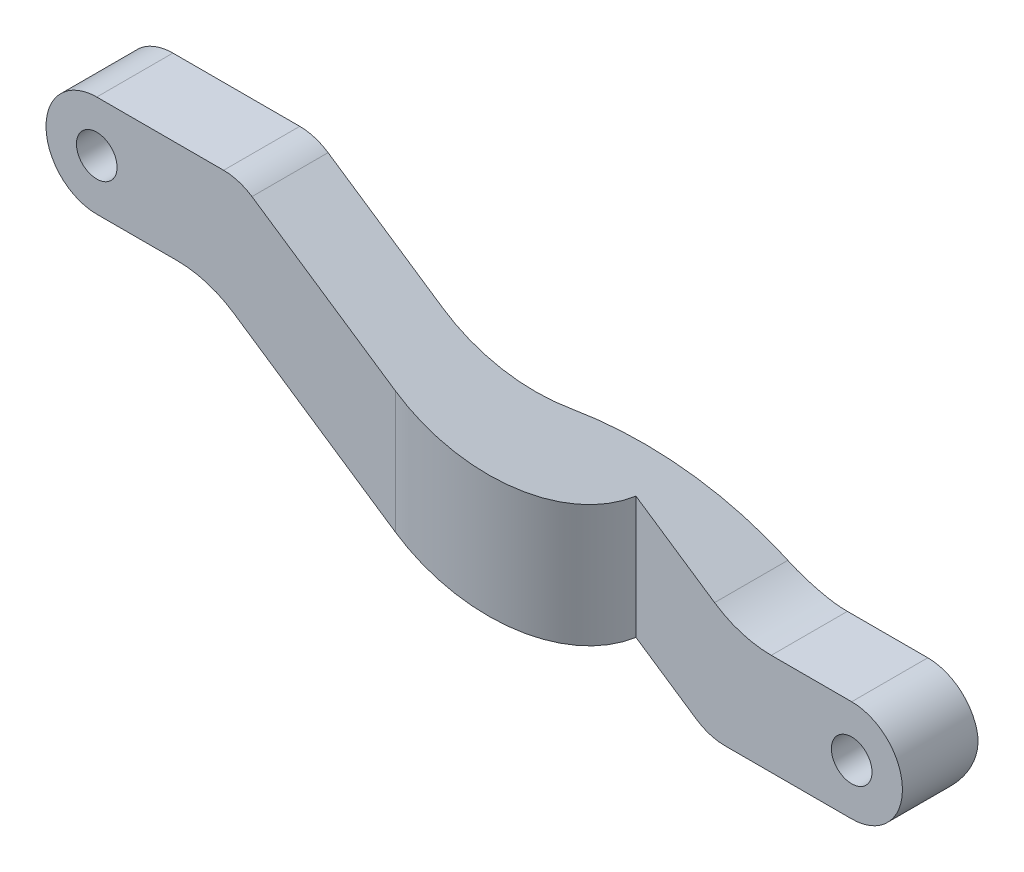
from build123d import *

# Parameters (mm, degrees)
BOSS_EXTRUDE1_START = -4.5
SKETCH1_R           = 0.8
BOSS_EXTRUDE1_DEPTH = 7.5
FILLET1_R           = 4
SKETCH4_W           = 10.5
SKETCH4_H           = 4.5
CUT_EXTRUDE2_DEPTH  = 29.619267985
SKETCH5_W           = 15
SKETCH5_H           = 4.5
CUT_EXTRUDE3_DEPTH  = 29.619267985
FILLET2_R           = 10
FILLET3_R           = 5
FILLET4_R           = 5
SKETCH7_W           = 29.25
SKETCH7_H           = 14.263139721
CUT_EXTRUDE4_DEPTH  = 7.5
CUT_EXTRUDE5_START  = -6.755354819
CUT_EXTRUDE5_DEPTH  = 8.755354819
SKETCH10_R          = 1.51
CUT_EXTRUDE6_DEPTH  = 1.5


# Read off the part's stored shape, not the designer's step: Mirror5, Cut-Extrude5
with BuildPart() as part:
    # Sketch1 → Boss-Extrude1 (new body)
    with BuildSketch(Plane.XY.offset(BOSS_EXTRUDE1_START)):
        with BuildLine():
            Line((-4.389678411, -3.5), (-19.133343362, 6.422379894))
            ThreePointArc((-19.133343362, 6.422379894), (-19.666253628, 6.676053774), (-20.25, 6.763139721))
            Line((-20.25, 6.763139721), (-25.25, 6.763139721))
            ThreePointArc((-25.25, 6.763139721), (-27.246991207, 4.872803379), (-25.468997361, 2.775165839))
            ThreePointArc((-25.468997361, 2.775165839), (-25.359663658, 2.766148514), (-25.25, 2.763139721))
            Line((-25.25, 2.763139721), (-20.860321589, 2.763139721))
            Line((-20.860321589, 2.763139721), (-6.116656638, -7.159240173))
            ThreePointArc((-6.116656638, -7.159240173), (-5.583746372, -7.412914053), (-5, -7.5))
            Line((-5, -7.5), (0, -7.5))
            ThreePointArc((0, -7.5), (1.974370247, -5.81915847), (0.630136986, -3.601862129))
            ThreePointArc((0.630136986, -3.601862129), (0.31915847, -3.525629753), (0, -3.5))
            Line((0, -3.5), (-4.389678411, -3.5))
        make_face()
        with Locations((0, -5.5)):
            Circle(SKETCH1_R, mode=Mode.SUBTRACT)
        with Locations((-25.25, 4.763139721)):
            Circle(SKETCH1_R, mode=Mode.SUBTRACT)
    extrude(amount=BOSS_EXTRUDE1_DEPTH)

    # Fillet1
    fillet1_edges = [part.edges().sort_by_distance(p)[0] for p in [
        (-4.389678411, -3.5, -0.75),
        (-20.860321589, 2.763139721, -0.75),
    ]]
    fillet(fillet1_edges, radius=FILLET1_R)

    # Sketch4 → Cut-Extrude2 (cut, symmetric)
    with BuildSketch(Plane(origin=(0, 0, 0), x_dir=(1, 0, 0), z_dir=(0, 1, 0))):
        with Locations((-3.25, 2.25)):
            Rectangle(SKETCH4_W, SKETCH4_H)
    extrude(amount=CUT_EXTRUDE2_DEPTH, both=True, mode=Mode.SUBTRACT)

    # Sketch5 → Cut-Extrude3 (cut, symmetric)
    with BuildSketch(Plane(origin=(0, 0, 0), x_dir=(1, 0, 0), z_dir=(0, 1, 0))):
        with Locations((-19.75, -0.75)):
            Rectangle(SKETCH5_W, SKETCH5_H)
    extrude(amount=CUT_EXTRUDE3_DEPTH, both=True, mode=Mode.SUBTRACT)

    # Fillet2
    # the kernel refuses this fillet: 10 mm, written as the material it takes off along each edge
    with BuildSketch(Plane(origin=(-12.25, -23.910660804, 3), x_dir=(1.537930276954748e-12, 0, -1.0), z_dir=(0, 1, 0))) as fillet2_piece_1:
        with BuildLine():
            CenterArc((10, -8.351646544), FILLET2_R, 123.367012969, 56.632987031)
            Line((0, -8.351646544), (-0.2, -8.351646544))
            Line((-0.2, -8.351646544), (-0.2, 0))
            Line((-0.2, 0), (0, 0.2))
            ThreePointArc((0, 0.2), (2.25, 0.2), (4.39, 0.167032931))
            Line((4.39, 0.167032931), (4.5, 0))
        make_face()
    extrude(amount=46.579716753, mode=Mode.SUBTRACT)

    # Fillet3
    # the kernel refuses this fillet: 5 mm, written as the material it takes off along each edge
    with BuildSketch(Plane(origin=(-8.5, -17.99261029, -4.5), x_dir=(0, 0, 1), z_dir=(0, 1, 0))) as fillet3_piece_1:
        with BuildLine():
            CenterArc((5, -4.974937186), FILLET3_R, 95.739170477, 84.260829523)
            Line((0, -4.974937186), (-0.1, -4.974937186))
            Line((-0.1, -4.974937186), (-0.1, 0))
            Line((-0.1, 0), (0, 0.1))
            ThreePointArc((0, 0.1), (2.25, 0.1), (4.49, 0.099498744))
            Line((4.49, 0.099498744), (4.5, 0))
        make_face()
    extrude(amount=29.696169959, mode=Mode.SUBTRACT)

    # Fillet4
    fillet4_edges = [part.edges().sort_by_distance(p)[0] for p in [
        (-12.25, -0.620802428, -1.5),
    ]]
    fillet(fillet4_edges, radius=FILLET4_R)

    # Mirror5: part across plane


with BuildPart() as part_1:
    add(part.part)
    add(part.part.mirror(Plane.XY.offset(-4.5)))

    # Sketch7 → Cut-Extrude4 (cut)
    with BuildSketch(Plane.XY.offset(3)):
        with Locations((-12.625, -0.36843014)):
            Rectangle(SKETCH7_W, SKETCH7_H)
    extrude(amount=-CUT_EXTRUDE4_DEPTH, mode=Mode.SUBTRACT)

    # Cut-Extrude5 outline → Cut-Extrude5 (cut)
    with BuildSketch(Plane(origin=(0, 0, 0), x_dir=(0, 0, -1), z_dir=(1, 0, 0)).offset(CUT_EXTRUDE5_START)):
        with BuildLine():
            add(Edge.make_bspline(
                [(10.5, -7.5), (12, -7.5), (12, -5)],
                knots=[0, 0, 0, 1.570796327, 1.570796327, 1.570796327], degree=2, weights=[1, 0.707106781, 1]))
            Line((10.5, -7.5), (12, -7.5))
            Line((12, -7.5), (12, -5))
        make_face()
    extrude(amount=CUT_EXTRUDE5_DEPTH, mode=Mode.SUBTRACT)

    # Sketch10 → Cut-Extrude6 (cut)
    with BuildSketch(Plane(origin=(0, 0, -12), x_dir=(-1, 0, 0), z_dir=(0, 0, -1))):
        with Locations((0, -5.5)):
            Circle(SKETCH10_R)
    extrude(amount=-CUT_EXTRUDE6_DEPTH, mode=Mode.SUBTRACT)


solid = part_1.part
